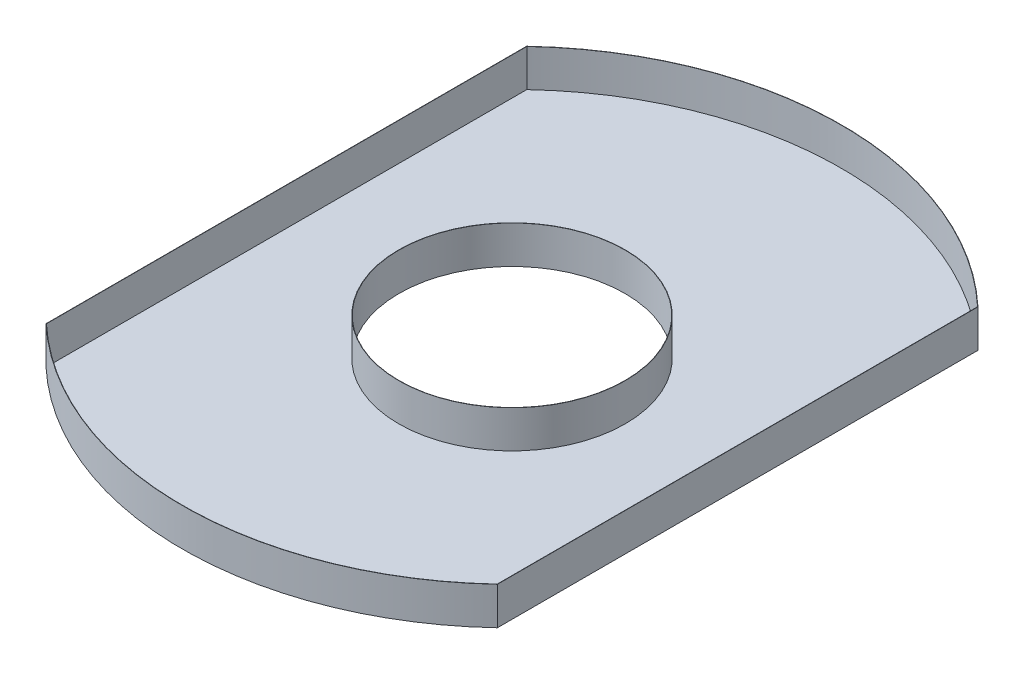
from build123d import *

# Parameters (mm, degrees)
SKETCH1_R                = 1750
BOSS_EXTRUDE1_DEPTH      = 500
SKETCH2_R                = 900
CUT_EXTRUDE2_DEPTH       = 300
CUT_EXTRUDE10_DEPTH      = 2525.876234591
CUT_EXTRUDE10_DEPTH_BACK = 2525.876234591
SKETCH10_W               = 4401.17604026
SKETCH10_H               = 5623.086471134
SKETCH10_W_2             = 2396.119838962
SKETCH10_H_2             = 4339.917258658
SKETCH3_R                = 600
CUT_EXTRUDE3_DEPTH       = 300
SHELL1_T                 = -1.5
SKETCH11_W               = 3093.35758239
SKETCH11_H               = 4860.990486612
CUT_EXTRUDE11_DEPTH      = 2142.92613567
SKETCH13_R               = 901.5
SKETCH13_R_2             = 601.5
CUT_EXTRUDE14_DEPTH      = 10


with BuildPart() as part:
    # Sketch1 → Boss-Extrude1 (new body)
    with BuildSketch(Plane(origin=(0, 0, 0), x_dir=(1, 0, 0), z_dir=(0, 1, 0))):
        Circle(SKETCH1_R)
    extrude(amount=BOSS_EXTRUDE1_DEPTH)

    # Sketch2 → Cut-Extrude2 (cut)
    with BuildSketch(Plane(origin=(0, 500, 0), x_dir=(1, 0, 0), z_dir=(0, 1, 0))):
        Circle(SKETCH2_R)
    extrude(amount=-CUT_EXTRUDE2_DEPTH, mode=Mode.SUBTRACT)

    # Sketch10 → Cut-Extrude10 (cut, two sides: drawn at the far end of the back side and taken through both)
    with BuildSketch(Plane(origin=(0, 500, 0), x_dir=(1, 0, 0), z_dir=(0, 1, 0)).offset(-CUT_EXTRUDE10_DEPTH_BACK)):
        Rectangle(SKETCH10_W, SKETCH10_H)
        Rectangle(SKETCH10_W_2, SKETCH10_H_2, mode=Mode.SUBTRACT)
    extrude(amount=CUT_EXTRUDE10_DEPTH + CUT_EXTRUDE10_DEPTH_BACK, mode=Mode.SUBTRACT)

    # Sketch3 → Cut-Extrude3 (cut)
    with BuildSketch(Plane.XZ):
        Circle(SKETCH3_R)
    extrude(amount=-CUT_EXTRUDE3_DEPTH, mode=Mode.SUBTRACT)

    # Shell1
    shell1_openings = [part.faces().sort_by_distance(p)[0] for p in [
        (1155.643660473, 500, 0),
    ]]
    offset(amount=SHELL1_T, openings=shell1_openings, kind=Kind.INTERSECTION)

    # Sketch11 → Cut-Extrude11 (cut, through all)
    with BuildSketch(Plane(origin=(0, 200, 0), x_dir=(1, 0, 0), z_dir=(0, 1, 0))):
        Rectangle(SKETCH11_W, SKETCH11_H)
    extrude(amount=CUT_EXTRUDE11_DEPTH, mode=Mode.SUBTRACT)

    # Sketch13 → Cut-Extrude14 (cut)
    with BuildSketch(Plane(origin=(0, 200, 0), x_dir=(1, 0, 0), z_dir=(0, 1, 0))):
        Circle(SKETCH13_R)
        Circle(SKETCH13_R_2, mode=Mode.SUBTRACT)
    extrude(amount=-CUT_EXTRUDE14_DEPTH, mode=Mode.SUBTRACT)


solid = part.part
